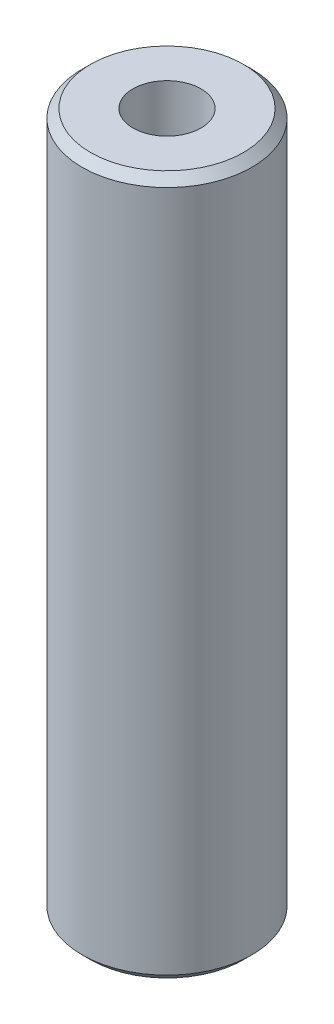
from build123d import *

# Parameters (mm, degrees)
SKETCH1_R           = 40
BOSS_EXTRUDE1_DEPTH = 329.132771345
SKETCH2_R           = 16.020800604
CUT_EXTRUDE1_DEPTH  = 334.958651892
CHAMFER1_SIZE       = 4.005094111


with BuildPart() as part:
    # Sketch1 → Boss-Extrude1 (new body)
    with BuildSketch(Plane(origin=(0, 0, 0), x_dir=(1, 0, 0), z_dir=(0, 1, 0))):
        Circle(SKETCH1_R)
    extrude(amount=BOSS_EXTRUDE1_DEPTH)

    # Sketch2 → Cut-Extrude1 (cut, through all)
    with BuildSketch(Plane(origin=(0, 0, 0), x_dir=(1, 0, 0), z_dir=(0, 1, 0))):
        Circle(SKETCH2_R)
    extrude(amount=CUT_EXTRUDE1_DEPTH, mode=Mode.SUBTRACT)

    # Chamfer1
    chamfer1_edges = [part.edges().sort_by_distance(p)[0] for p in [
        (-40, 329.132771345, 0),
        (-40, 0, 0),
    ]]
    chamfer(chamfer1_edges, length=CHAMFER1_SIZE)


solid = part.part
